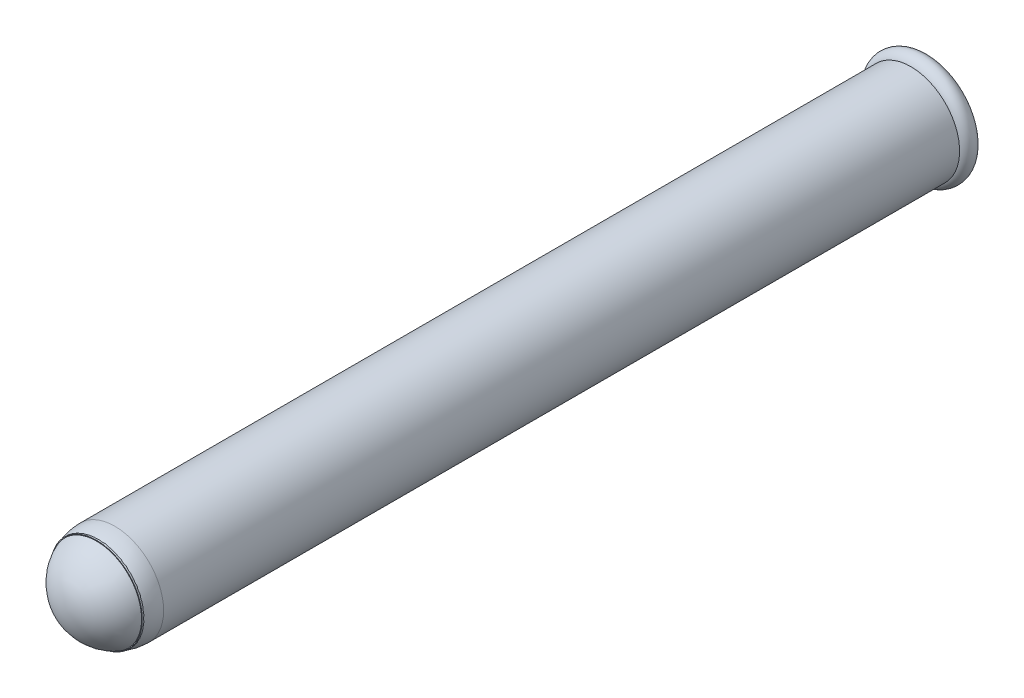
from build123d import *

# Parameters (mm, degrees)
SKETCH40_R          = 8
BOSS_EXTRUDE4_DEPTH = 140
SKETCH41_R          = 7.5
CUT_EXTRUDE3_DEPTH  = 135
FILLET5_R           = 8


# Read off the part's stored shape, not the designer's step: Sweep3
with BuildPart() as part:
    # Sketch40 → Boss-Extrude4 (new body)
    with BuildSketch(Plane.XY):
        Circle(SKETCH40_R)
    extrude(amount=BOSS_EXTRUDE4_DEPTH)

    # Sketch41 → Cut-Extrude3 (cut)
    with BuildSketch(Plane(origin=(0, 0, 0), x_dir=(-1, 0, 0), z_dir=(0, 0, -1))):
        Circle(SKETCH41_R)
    extrude(amount=-CUT_EXTRUDE3_DEPTH, mode=Mode.SUBTRACT)

    # Sweep3 outline → Sweep3 (revolve)
    with BuildSketch(Plane.XZ):
        with BuildLine():
            Line((8, 1.414213562), (8, 0))
            Line((8, 0), (7.5, 0))
            Line((7.5, 0), (7.5, 1.5))
            ThreePointArc((7.5, 1.5), (7.24634703, -1.478397839), (8, 1.414213562))
        make_face()
    revolve(axis=Axis((0, 0, 0), (0, 0, 1)))

    # Fillet5
    fillet5_edges = [part.edges().sort_by_distance(p)[0] for p in [
        (-8, 0, 140),
    ]]
    fillet(fillet5_edges, radius=FILLET5_R)


solid = part.part
